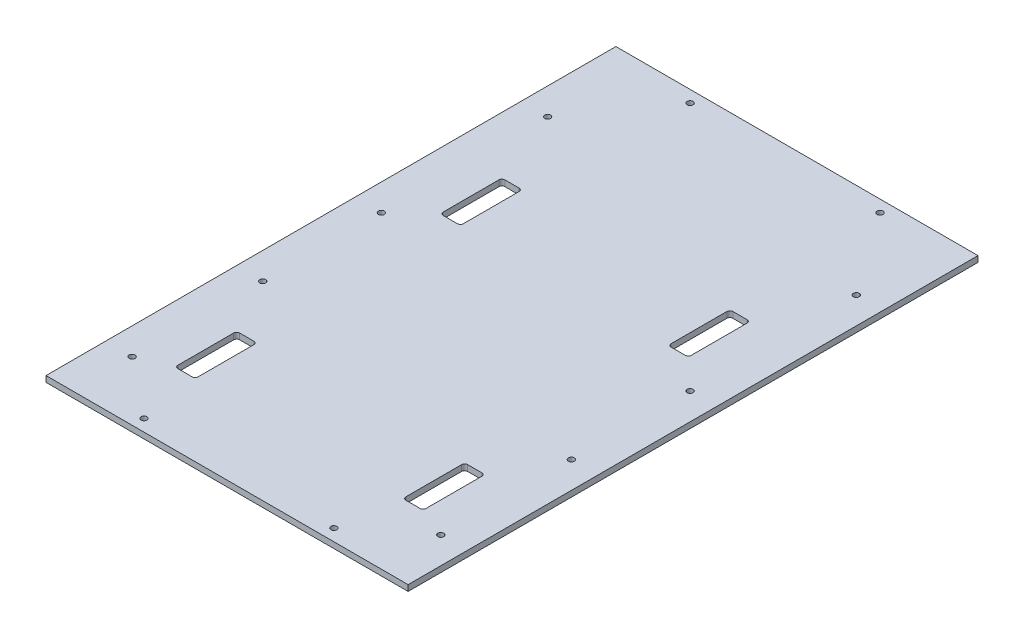
from build123d import *

# Parameters (mm, degrees)
SKETCH1_W           = 387.35
SKETCH1_H           = 609.6
BOSS_EXTRUDE1_DEPTH = 6.35
SKETCH2_W           = 21.59
SKETCH2_H           = 66.04
CUT_EXTRUDE1_DEPTH  = 362.183288823
FILLET1_R           = 3.175
SKETCH3_R           = 3.175
CUT_EXTRUDE2_DEPTH  = 362.183288823


with BuildPart() as part:
    # Sketch1 → Boss-Extrude1 (new body)
    with BuildSketch(Plane(origin=(0, 0, 0), x_dir=(1, 0, 0), z_dir=(0, 1, 0))):
        Rectangle(SKETCH1_W, SKETCH1_H)
    extrude(amount=BOSS_EXTRUDE1_DEPTH)

    # Sketch2 → Cut-Extrude1 (cut, through all)
    with BuildSketch(Plane(origin=(0, 6.35, 0), x_dir=(1, 0, 0), z_dir=(0, 1, 0))):
        with Locations((121.92, -194.818)):
            Rectangle(SKETCH2_W, SKETCH2_H)
        with Locations((121.92, 88.9)):
            Rectangle(SKETCH2_W, SKETCH2_H)
        with Locations((-121.92, -194.818)):
            Rectangle(SKETCH2_W, SKETCH2_H)
        with Locations((-121.92, 88.9)):
            Rectangle(SKETCH2_W, SKETCH2_H)
    extrude(amount=-CUT_EXTRUDE1_DEPTH, mode=Mode.SUBTRACT)

    # Fillet1
    fillet1_edges = [part.edges().sort_by_distance(p)[0] for p in [
        (-132.715, 3.175, -121.92),
        (-111.125, 3.175, -121.92),
        (132.715, 3.175, 227.838),
        (132.715, 3.175, 161.798),
        (111.125, 3.175, 161.798),
        (111.125, 3.175, 227.838),
        (-111.125, 3.175, 227.838),
        (-132.715, 3.175, 227.838),
        (-111.125, 3.175, 161.798),
        (-132.715, 3.175, 161.798),
        (132.715, 3.175, -55.88),
        (111.125, 3.175, -55.88),
        (132.715, 3.175, -121.92),
        (111.125, 3.175, -121.92),
        (-111.125, 3.175, -55.88),
        (-132.715, 3.175, -55.88),
    ]]
    fillet(fillet1_edges, radius=FILLET1_R)

    # Sketch3 → Cut-Extrude2 (cut, through all)
    with BuildSketch(Plane(origin=(0, 0, 0), x_dir=(-1, 0, 0), z_dir=(0, -1, 0))):
        with Locations((101.6, 292.1)):
            Circle(SKETCH3_R)
        with Locations((165.1, 203.2)):
            Circle(SKETCH3_R)
        with Locations((165.1, -101.6)):
            Circle(SKETCH3_R)
        with Locations((165.1, 25.4)):
            Circle(SKETCH3_R)
        with Locations((165.1, -241.3)):
            Circle(SKETCH3_R)
        with Locations((-165.1, -241.3)):
            Circle(SKETCH3_R)
        with Locations((-165.1, -101.6)):
            Circle(SKETCH3_R)
        with Locations((-165.1, 25.4)):
            Circle(SKETCH3_R)
        with Locations((-165.1, 203.2)):
            Circle(SKETCH3_R)
        with Locations((-101.6, 292.1)):
            Circle(SKETCH3_R)
        with Locations((101.6, -292.1)):
            Circle(SKETCH3_R)
        with Locations((-101.6, -292.1)):
            Circle(SKETCH3_R)
    extrude(amount=-CUT_EXTRUDE2_DEPTH, mode=Mode.SUBTRACT)


solid = part.part
